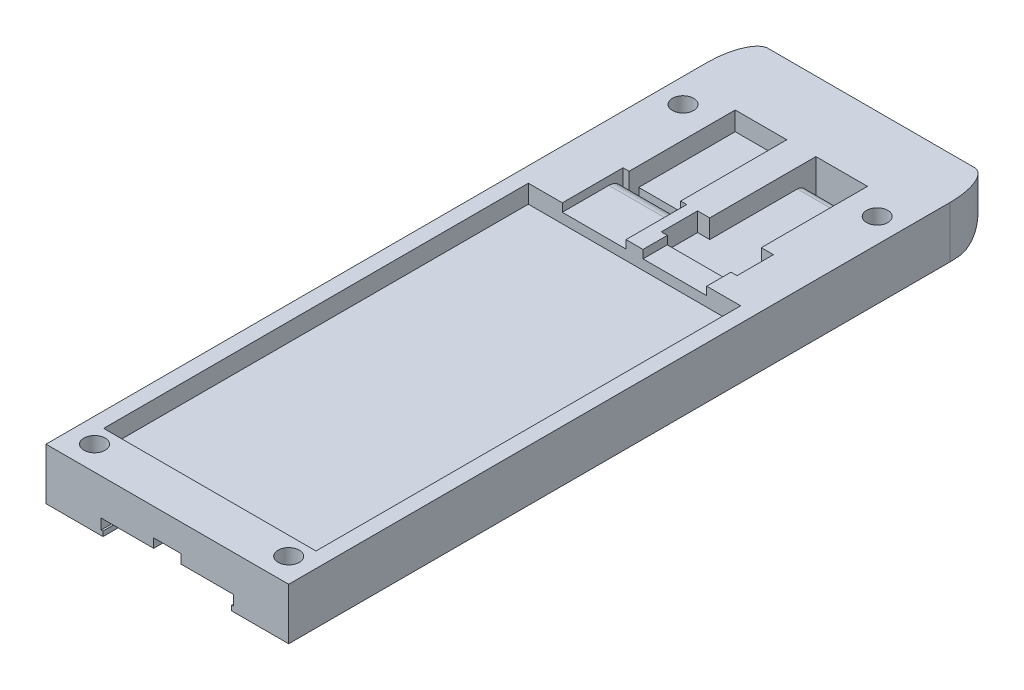
from build123d import *

# Parameters (mm, degrees)
SKETCH1_W                  = 40
SKETCH1_H                  = 106
BOSS_EXTRUDE1_DEPTH        = 8.5
SKETCH2_W                  = 35
SKETCH2_H                  = 70
CUT_EXTRUDE1_DEPTH         = 3
SKETCH3_W                  = 10.5
SKETCH3_H                  = 10
CUT_EXTRUDE2_DEPTH         = 1.35
SKETCH4_W                  = 12.5
SKETCH4_H                  = 6
CUT_EXTRUDE3_DEPTH         = 3.1
SKETCH5_W                  = 8.5
SKETCH5_H                  = 17.5
PCB_PLACE_DEPTH            = 3.1
SKETCH6_W                  = 8.5
SKETCH6_H                  = 1.6
NICKEL_STRIP_HOLE_DEPTH    = 70.174850921
CUT_EXTRUDE4_REACH         = 71.486
SKETCH7_W                  = 8.5
SKETCH7_H                  = 17.5
SKETCH8_W                  = 8.5
SKETCH8_H                  = 1.6
CUT_EXTRUDE5_DEPTH         = 10
SKETCH9_W                  = 8.5
SKETCH9_H                  = 106
NICKEL_STRIP_RAIL_DEPTH    = 2.5
FILLET3_R                  = 2.325
FILLET4_RADIUS             = 1.45
FILLET4_LENGTH             = 8.5
SKETCH10_W                 = 8.5
SKETCH10_H                 = 5
CUT_EXTRUDE6_DEPTH         = 1.5
SKETCH11_W                 = 8.5
SKETCH11_H                 = 0.7
NICKELSTRIPINSERTION_DEPTH = 18
FILLET5_INSERTION_START    = -10.9
FILLET5_INSERTION_DEPTH    = 8.5
FILLET5_INSERTION_START_2  = 2.4
FILLET5_INSERTION_2_DEPTH  = 8.5
FILLET7_AMEND_R            = 4
FILLET6_START              = -10.9
FILLET6_DEPTH              = 8.5
FILLET6_START_2            = 2.4
FILLET6_2_DEPTH            = 8.5
FILLET8_ROUNDING_R         = 0.1
SKETCH12_W                 = 0.3
SKETCH12_H                 = 0.8
STRIPRAIL_DEPTH            = 70
SKETCH13_R                 = 1.75
SCREW_HOLES_DEPTH          = 70.485610128
SKETCH14_R                 = 3.5
SCREW_HEAD_HOLES_TBM_DEPTH = 4.5
BOSS_EXTRUDE2_DEPTH        = 10
FILLET12_SIZE              = 7
FILLET12_SIZE_2            = 3
FILLET11_R                 = 5.5
SKETCH17_W                 = 4.5
SKETCH17_H                 = 4
CUT_EXTRUDE9_DEPTH         = 116
SKETCH18_W                 = 5.4
SKETCH18_H                 = 2.5
CUT_EXTRUDE10_DEPTH        = 116


with BuildPart() as part:
    # Sketch1 → Boss-Extrude1 (new body)
    with BuildSketch(Plane(origin=(0, 0, 0), x_dir=(1, 0, 0), z_dir=(0, 1, 0))):
        with Locations((0, 13)):
            Rectangle(SKETCH1_W, SKETCH1_H)
    extrude(amount=BOSS_EXTRUDE1_DEPTH)

    # Sketch2 → Cut-Extrude1 (cut)
    with BuildSketch(Plane(origin=(0, 8.5, 0), x_dir=(1, 0, 0), z_dir=(0, 1, 0))):
        with Locations((0, 2)):
            Rectangle(SKETCH2_W, SKETCH2_H)
    extrude(amount=-CUT_EXTRUDE1_DEPTH, mode=Mode.SUBTRACT)

    # Sketch3 → Cut-Extrude2 (cut)
    with BuildSketch(Plane(origin=(0, 8.5, 0), x_dir=(1, 0, 0), z_dir=(0, 1, 0))):
        with Locations((-6.65, 42)):
            Rectangle(SKETCH3_W, SKETCH3_H)
        with Locations((6.65, 42)):
            Rectangle(SKETCH3_W, SKETCH3_H)
    extrude(amount=-CUT_EXTRUDE2_DEPTH, mode=Mode.SUBTRACT)

    # Sketch4 → Cut-Extrude3 (cut)
    with BuildSketch(Plane(origin=(0, 8.5, 0), x_dir=(1, 0, 0), z_dir=(0, 1, 0))):
        with Locations((6.65, 44)):
            Rectangle(SKETCH4_W, SKETCH4_H)
    extrude(amount=-CUT_EXTRUDE3_DEPTH, mode=Mode.SUBTRACT)

    # Sketch5 → PCB place (cut)
    with BuildSketch(Plane(origin=(0, 8.5, 0), x_dir=(1, 0, 0), z_dir=(0, 1, 0))):
        with Locations((6.65, 55.75)):
            Rectangle(SKETCH5_W, SKETCH5_H)
    extrude(amount=-PCB_PLACE_DEPTH, mode=Mode.SUBTRACT)

    # Sketch6 → Nickel strip hole (cut, through all)
    with BuildSketch(Plane(origin=(0, 5.4, 0), x_dir=(1, 0, 0), z_dir=(0, 1, 0))):
        with Locations((6.65, 63.7)):
            Rectangle(SKETCH6_W, SKETCH6_H)
    extrude(amount=-NICKEL_STRIP_HOLE_DEPTH, mode=Mode.SUBTRACT)

    # Cut-Extrude4: up to this face of the body (flat: up to its plane)
    cut_extrude4_end = Plane(part.part.faces().sort_by_distance((6.65, 5.4, -51.042077088))[0])
    # Sketch7 → Cut-Extrude4 (cut, up to the picked face)
    with BuildSketch(Plane(origin=(0, 8.5, 0), x_dir=(1, 0, 0), z_dir=(0, 1, 0)), mode=Mode.PRIVATE) as cut_extrude4_sk1:
        with Locations((-6.65, 55.75)):
            Rectangle(SKETCH7_W, SKETCH7_H)
    cut_extrude4_tool1 = split(extrude(cut_extrude4_sk1.sketch, amount=-CUT_EXTRUDE4_REACH, mode=Mode.PRIVATE), bisect_by=cut_extrude4_end, keep=Keep.BOTH, mode=Mode.PRIVATE)
    add(cut_extrude4_tool1.solids().sort_by(Axis((-6.65, 8.5, -55.75), (0, -1, 0)))[0], mode=Mode.SUBTRACT)

    # Sketch8 → Cut-Extrude5 (cut)
    with BuildSketch(Plane(origin=(0, 5.4, 0), x_dir=(1, 0, 0), z_dir=(0, 1, 0))):
        with Locations((-6.65, 47.8)):
            Rectangle(SKETCH8_W, SKETCH8_H)
    extrude(amount=-CUT_EXTRUDE5_DEPTH, mode=Mode.SUBTRACT)

    # Sketch9 → Nickel strip rail (cut)
    with BuildSketch(Plane.XZ):
        with Locations((-6.65, -13)):
            Rectangle(SKETCH9_W, SKETCH9_H)
        with Locations((6.65, -13)):
            Rectangle(SKETCH9_W, SKETCH9_H)
    extrude(amount=-NICKEL_STRIP_RAIL_DEPTH, mode=Mode.SUBTRACT)

    # Fillet3
    # the kernel refuses this fillet: 2.325 mm, written as the material it takes off along each edge
    with BuildSketch(Plane(origin=(3.4125, 7.15, -47), x_dir=(0, 0, 1), z_dir=(-1, 0, 0))) as fillet3_piece_1_section:
        with BuildLine():
            CenterArc((FILLET3_R, -FILLET3_R), FILLET3_R, 90, 90)
            Line((0, -FILLET3_R), (0, 0))
            Line((0, 0), (FILLET3_R, 0))
        make_face()
    fillet3_piece_1 = extrude(amount=20.125, mode=Mode.PRIVATE)
    fillet3_piece_1 = split(fillet3_piece_1, bisect_by=Plane(origin=(-11.9, 7.15, -47), z_dir=(1, 0, 0)), keep=Keep.TOP, mode=Mode.PRIVATE)
    fillet3_piece_1 = split(fillet3_piece_1, bisect_by=Plane(origin=(-1.4, 7.15, -47), z_dir=(-1, 0, 0)), keep=Keep.TOP, mode=Mode.PRIVATE)
    add(fillet3_piece_1, mode=Mode.SUBTRACT)
    with BuildSketch(Plane(origin=(-10.9, 2.5, -47), x_dir=(0, 1, 0), z_dir=(1, 0, 0))) as fillet3_piece_2:
        with BuildLine():
            CenterArc((FILLET3_R, FILLET3_R), FILLET3_R, 180, 90)
            Line((0, FILLET3_R), (0, 0))
            Line((0, 0), (FILLET3_R, 0))
        make_face()
    extrude(amount=8.5, mode=Mode.SUBTRACT)

    # Fillet4: full round fillet: the end face becomes a half cylinder, R = half its width
    fillet4_face = Plane((6.65, 3.95, -62.9), x_dir=(1, 0, 0), z_dir=(0, 0, -1))  # on the end face: x along it, z out of the body
    fillet4_slab = fillet4_face.offset(-FILLET4_RADIUS / 2) * Box(FILLET4_LENGTH, 2 * FILLET4_RADIUS, FILLET4_RADIUS, mode=Mode.PRIVATE)  # the body's end, R deep
    fillet4_round = Plane((6.65, 3.95, -61.45), x_dir=(0, 0, -1), z_dir=(1, 0, 0)) * Cylinder(FILLET4_RADIUS, FILLET4_LENGTH, mode=Mode.PRIVATE)  # its axis R under the face
    add(fillet4_slab - fillet4_round, mode=Mode.SUBTRACT)

    # Sketch10 → Cut-Extrude6 (cut)
    with BuildSketch(Plane.XZ.offset(-2.5)):
        with Locations((6.65, 6.5)):
            Rectangle(SKETCH10_W, SKETCH10_H)
        with Locations((-6.65, 6.5)):
            Rectangle(SKETCH10_W, SKETCH10_H)
    extrude(amount=-CUT_EXTRUDE6_DEPTH, mode=Mode.SUBTRACT)

    # Sketch11 → NickelStripInsertion (cut)
    with BuildSketch(Plane(origin=(0, 0, 9), x_dir=(-1, 0, 0), z_dir=(0, 0, -1))):
        with Locations((-6.65, 3.65)):
            Rectangle(SKETCH11_W, SKETCH11_H)
        with Locations((6.65, 3.65)):
            Rectangle(SKETCH11_W, SKETCH11_H)
    extrude(amount=-NICKELSTRIPINSERTION_DEPTH, mode=Mode.SUBTRACT)

    # Fillet5_insertion: read off the stored shape, not the designer's step
    # Fillet5_insertion outline → Fillet5_insertion (cut)
    with BuildSketch(Plane.YZ.offset(FILLET5_INSERTION_START)):
        with BuildLine():
            Line((2.5, 4), (2.5, -8.359207094))
            add(Edge.make_bspline(
                [(2.5, -8.359207094), (2.5, 2.968380423), (4, 4)],
                knots=[0, 0, 0, 1, 1, 1], degree=2, weights=[1, 0.885061203, 1]))
            Line((4, 4), (2.5, 4))
        make_face()
    extrude(amount=FILLET5_INSERTION_DEPTH, mode=Mode.SUBTRACT)

    # Fillet5_insertion 2 outline → Fillet5_insertion 2 (cut)
    with BuildSketch(Plane.YZ.offset(FILLET5_INSERTION_START_2)):
        with BuildLine():
            Line((2.5, 4), (2.5, -8.359207094))
            add(Edge.make_bspline(
                [(2.5, -8.359207094), (2.5, 2.968380423), (4, 4)],
                knots=[0, 0, 0, 1, 1, 1], degree=2, weights=[1, 0.885061203, 1]))
            Line((4, 4), (2.5, 4))
        make_face()
    extrude(amount=FILLET5_INSERTION_2_DEPTH, mode=Mode.SUBTRACT)

    # Fillet7_amend
    fillet7_amend_edges = [part.edges().sort_by_distance(p)[0] for p in [
        (6.65, 4, 4),
        (-6.65, 4, 4),
    ]]
    fillet(fillet7_amend_edges, radius=FILLET7_AMEND_R)

    # Fillet6: read off the stored shape, not the designer's step
    # Fillet6 outline → Fillet6 (cut)
    with BuildSketch(Plane.YZ.offset(FILLET6_START)):
        with BuildLine():
            Line((3.3, 9), (3.3, 16.909487973))
            add(Edge.make_bspline(
                [(3.3, 16.909487973), (3.3, 9.121373217), (2.5, 9)],
                knots=[0, 0, 0, 1, 1, 1], degree=2, weights=[1, 0.758287544, 1]))
            Line((2.5, 9), (3.3, 9))
        make_face()
    extrude(amount=FILLET6_DEPTH, mode=Mode.SUBTRACT)

    # Fillet6 2 outline → Fillet6 2 (cut)
    with BuildSketch(Plane.YZ.offset(FILLET6_START_2)):
        with BuildLine():
            Line((3.3, 9), (3.3, 16.909487973))
            add(Edge.make_bspline(
                [(3.3, 16.909487973), (3.3, 9.121373217), (2.5, 9)],
                knots=[0, 0, 0, 1, 1, 1], degree=2, weights=[1, 0.758287544, 1]))
            Line((2.5, 9), (3.3, 9))
        make_face()
    extrude(amount=FILLET6_2_DEPTH, mode=Mode.SUBTRACT)

    # Fillet8_rounding
    fillet8_rounding_edges = [part.edges().sort_by_distance(p)[0] for p in [
        (-6.65, 2.5, 9),
        (6.65, 2.5, 9),
    ]]
    fillet(fillet8_rounding_edges, radius=FILLET8_ROUNDING_R)

    # Sketch12 → StripRail (add)
    with BuildSketch(Plane.XY.offset(40)):
        with Locations((2.55, 0.4)):
            Rectangle(SKETCH12_W, SKETCH12_H)
        with Locations((-10.75, 0.4)):
            Rectangle(SKETCH12_W, SKETCH12_H)
        with Locations((-2.55, 0.4)):
            Rectangle(SKETCH12_W, SKETCH12_H)
        with Locations((10.75, 0.4)):
            Rectangle(SKETCH12_W, SKETCH12_H)
    extrude(amount=-STRIPRAIL_DEPTH)

    # Sketch13 → Screw_Holes (cut, through all)
    with BuildSketch(Plane.XZ):
        with Locations(Location((-16, -61, 0), (0, 0, 270))):
            Circle(SKETCH13_R)
        with Locations(Location((16, -61, 0), (0, 0, 270))):
            Circle(SKETCH13_R)
        with Locations(Location((-16, 36, 0), (0, 0, 270))):
            Circle(SKETCH13_R)
        with Locations(Location((16, 36, 0), (0, 0, 270))):
            Circle(SKETCH13_R)
    extrude(amount=-SCREW_HOLES_DEPTH, mode=Mode.SUBTRACT)

    # Sketch14 → Screw_Head_Holes_TBM (cut)
    with BuildSketch(Plane.XZ):
        with Locations(Location((16, -61, 0), (0, 0, 270))):
            Circle(SKETCH14_R)
        with Locations(Location((-16, -61, 0), (0, 0, 270))):
            Circle(SKETCH14_R)
        with Locations(Location((16, 36, 0), (0, 0, 270))):
            Circle(SKETCH14_R)
        with Locations(Location((-16, 36, 0), (0, 0, 270))):
            Circle(SKETCH14_R)
    extrude(amount=-SCREW_HEAD_HOLES_TBM_DEPTH, mode=Mode.SUBTRACT)

    # Sketch15 → Boss-Extrude2 (add)
    with BuildSketch(Plane(origin=(0, 0, -66), x_dir=(-1, 0, 0), z_dir=(0, 0, -1))):
        Polygon((-20, 0), (-20, 8.5), (20, 8.5), (20, 0), (10.9, 0), (10.9, 2.5), (2.4, 2.5), (2.4, 0), (-2.4, 0), (-2.4, 2.5), (-10.9, 2.5), (-10.9, 0), align=None)
    extrude(amount=BOSS_EXTRUDE2_DEPTH)

    # Fillet12
    # a fillet whose section is not a circle: 7, 3 mm, written as the material it takes off along each edge
    with BuildSketch(Plane(origin=(20, -17.5, -76), x_dir=(0, 0, 1), z_dir=(0, 1, 0)), Plane(origin=(-20, 26, -76), x_dir=(0, 0, 1), z_dir=(0, -1, 0))) as fillet12_piece_1:
        with BuildLine():
            Bezier((FILLET12_SIZE, 0), (0, 0), (0, -FILLET12_SIZE_2), weights=[1, 0.707106781, 1])
            Line((0, -FILLET12_SIZE_2), (0, 0))
            Line((0, 0), (FILLET12_SIZE, 0))
        make_face()
    extrude(amount=43.5, mode=Mode.SUBTRACT)

    # Fillet11
    # the kernel refuses this fillet: 5.5 mm, written as the material it takes off along each edge
    with BuildSketch(Plane(origin=(-16.15, 0, -76), x_dir=(0, 1, 0), z_dir=(1, 0, 0))) as fillet11_piece_1:
        with BuildLine():
            CenterArc((FILLET11_R, FILLET11_R), FILLET11_R, 180, 90)
            Line((0, FILLET11_R), (0, 0))
            Line((0, 0), (FILLET11_R, 0))
        make_face()
    extrude(amount=32.3, mode=Mode.SUBTRACT)
    with BuildSketch(Plane(origin=(-30.75, 0, -76), x_dir=(0, 0, 1), z_dir=(1, 0, 0))) as fillet11_piece_2:
        with BuildLine():
            CenterArc((FILLET11_R, -FILLET11_R), FILLET11_R, 90, 90)
            Line((0, -FILLET11_R), (0, 0))
            Line((0, 0), (FILLET11_R, 0))
        make_face()
    extrude(amount=33.6, mode=Mode.SUBTRACT)
    with BuildSketch(Plane(origin=(-2.85, 0, -76), x_dir=(0, 1, 0), z_dir=(1, 0, 0))) as fillet11_piece_3:
        with BuildLine():
            CenterArc((FILLET11_R, FILLET11_R), FILLET11_R, 180, 90)
            Line((0, FILLET11_R), (0, 0))
            Line((0, 0), (FILLET11_R, 0))
        make_face()
    extrude(amount=33.6, mode=Mode.SUBTRACT)

    # Sketch17 → Cut-Extrude9 (cut)
    with BuildSketch(Plane.XY.offset(40)):
        with Locations((0, 2)):
            Rectangle(SKETCH17_W, SKETCH17_H)
    extrude(amount=-CUT_EXTRUDE9_DEPTH, mode=Mode.SUBTRACT)

    # Sketch18 → Cut-Extrude10 (cut)
    with BuildSketch(Plane.XY.offset(40)):
        with Locations((0, 1.25)):
            Rectangle(SKETCH18_W, SKETCH18_H)
    extrude(amount=-CUT_EXTRUDE10_DEPTH, mode=Mode.SUBTRACT)


solid = part.part
